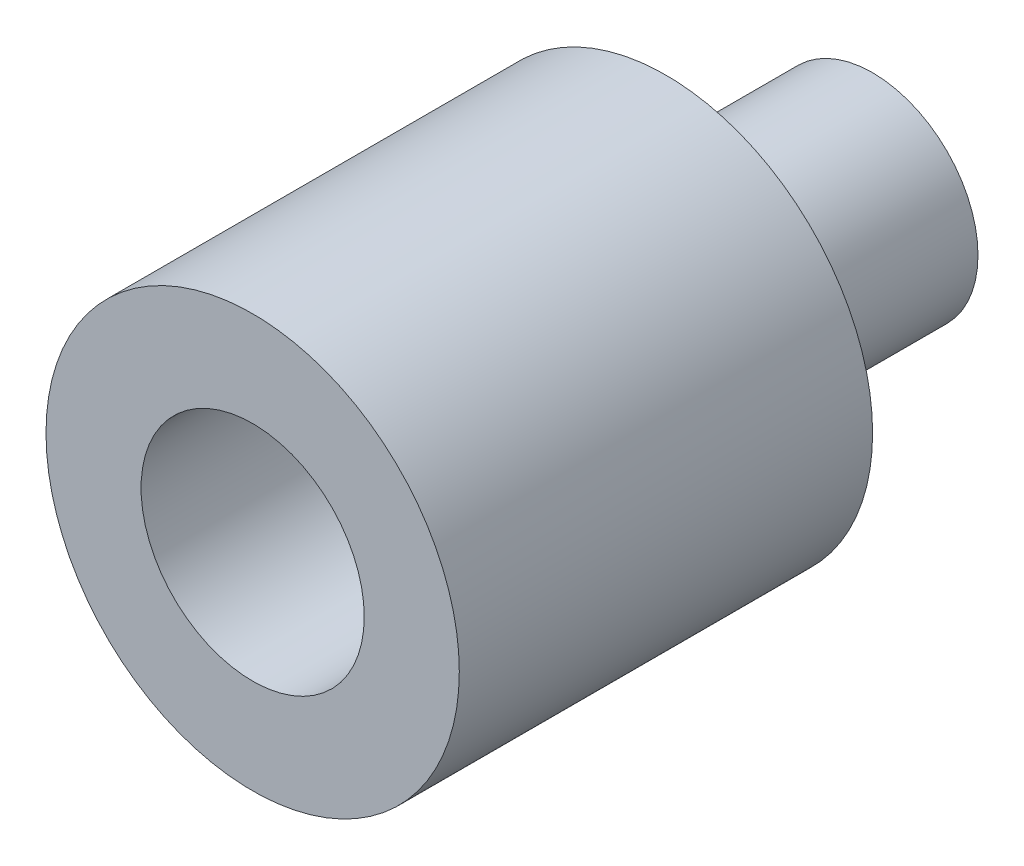
from build123d import *

# Parameters (mm, degrees)
SKETCH1_R           = 2.55
BOSS_EXTRUDE1_DEPTH = 5
SKETCH2_R           = 5
BOSS_EXTRUDE2_DEPTH = 10
SKETCH3_R           = 2.7
CUT_EXTRUDE1_DEPTH  = 8


with BuildPart() as part:
    # Sketch1 → Boss-Extrude1 (new body)
    with BuildSketch(Plane.XY):
        Circle(SKETCH1_R)
    extrude(amount=BOSS_EXTRUDE1_DEPTH)

    # Sketch2 → Boss-Extrude2 (add)
    with BuildSketch(Plane.XY.offset(5)):
        Circle(SKETCH2_R)
    extrude(amount=BOSS_EXTRUDE2_DEPTH)

    # Sketch3 → Cut-Extrude1 (cut)
    with BuildSketch(Plane.XY.offset(15)):
        Circle(SKETCH3_R)
    extrude(amount=-CUT_EXTRUDE1_DEPTH, mode=Mode.SUBTRACT)


solid = part.part
